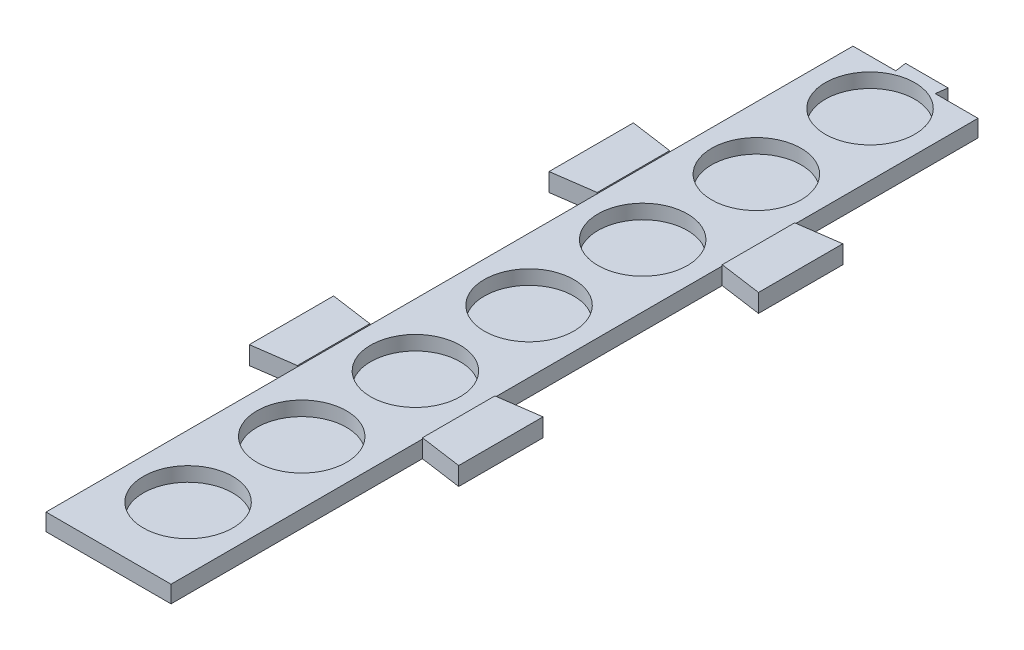
from build123d import *

# Parameters (mm, degrees)
SKETCH1_W           = 27.94
SKETCH1_H           = 391.16
BOSS_EXTRUDE1_DEPTH = 3.81
SKETCH2_R           = 10
CUT_EXTRUDE1_DEPTH  = 3.21
BOSS_EXTRUDE2_DEPTH = 4.064
SKETCH7_W           = 46.80460671
SKETCH7_H           = 4.064
CUT_EXTRUDE2_DEPTH  = 210.82
BOSS_EXTRUDE4_DEPTH = 4.064


with BuildPart() as part:
    # Sketch1 → Boss-Extrude1 (new body)
    with BuildSketch(Plane(origin=(0, 0, 0), x_dir=(1, 0, 0), z_dir=(0, 1, 0))):
        Rectangle(SKETCH1_W, SKETCH1_H)
    extrude(amount=BOSS_EXTRUDE1_DEPTH)

    # Sketch2 → Cut-Extrude1 (cut)
    with BuildSketch(Plane(origin=(0, 3.81, 0), x_dir=(1, 0, 0), z_dir=(0, 1, 0))):
        with Locations((0, 177.8)):
            Circle(SKETCH2_R)
        with Locations((0, 152.4)):
            Circle(SKETCH2_R)
        with Locations((0, 127)):
            Circle(SKETCH2_R)
        with Locations((0, 101.6)):
            Circle(SKETCH2_R)
        with Locations((0, 76.2)):
            Circle(SKETCH2_R)
        with Locations((0, 50.8)):
            Circle(SKETCH2_R)
        with Locations((0, 25.4)):
            Circle(SKETCH2_R)
        Circle(SKETCH2_R)
        with Locations((0, -25.4)):
            Circle(SKETCH2_R)
        with Locations((0, -50.8)):
            Circle(SKETCH2_R)
        with Locations((0, -76.2)):
            Circle(SKETCH2_R)
        with Locations((0, -101.6)):
            Circle(SKETCH2_R)
        with Locations((0, -127)):
            Circle(SKETCH2_R)
        with Locations((0, -152.4)):
            Circle(SKETCH2_R)
        with Locations((0, -177.8)):
            Circle(SKETCH2_R)
    extrude(amount=-CUT_EXTRUDE1_DEPTH, mode=Mode.SUBTRACT)

    # Sketch4 → Boss-Extrude2 (add)
    with BuildSketch(Plane(origin=(0, 0, 0), x_dir=(1, 0, 0), z_dir=(0, 1, 0))):
        Polygon((23.402303355, -54.881033493), (13.97, -56.20665728), (13.97, -72.402209707), (23.402303355, -73.727833493), align=None)
        Polygon((23.402303355, 146.105623787), (13.97, 144.78), (13.97, 128.584447573), (23.402303355, 127.258823787), align=None)
        Polygon((-13.97, 128.584447573), (-13.97, 144.78), (-23.402303355, 146.105623787), (-23.402303355, 127.258823787), align=None)
        Polygon((23.402303355, 79.11007136), (13.97, 77.784447573), (13.97, 61.588895147), (23.402303355, 60.26327136), align=None)
        Polygon((23.402303355, 12.114518933), (13.97, 10.788895147), (13.97, -5.40665728), (23.402303355, -6.732281067), align=None)
        Polygon((-13.97, -5.40665728), (-13.97, 10.788895147), (-23.402303355, 12.114518933), (-23.402303355, -6.732281067), align=None)
        Polygon((-13.97, 61.588895147), (-13.97, 77.784447573), (-23.402303355, 79.11007136), (-23.402303355, 60.26327136), align=None)
        Polygon((23.402303355, -121.87658592), (13.97, -123.202209707), (13.97, -139.397762134), (23.402303355, -140.72338592), align=None)
        Polygon((-13.97, -139.397762134), (-13.97, -123.202209707), (-23.402303355, -121.87658592), (-23.402303355, -140.72338592), align=None)
        Polygon((-13.97, -72.402209707), (-13.97, -56.20665728), (-23.402303355, -54.881033493), (-23.402303355, -73.727833493), align=None)
    extrude(amount=BOSS_EXTRUDE2_DEPTH)

    # Sketch7 → Cut-Extrude2 (cut)
    with BuildSketch(Plane(origin=(0, 0, -195.58), x_dir=(-1, 0, 0), z_dir=(0, 0, -1))):
        with Locations((0, 2.032)):
            Rectangle(SKETCH7_W, SKETCH7_H)
    extrude(amount=-CUT_EXTRUDE2_DEPTH, mode=Mode.SUBTRACT)

    # Sketch8 → Boss-Extrude4 (add)
    with BuildSketch(Plane(origin=(0, 3.81, 0), x_dir=(1, 0, 0), z_dir=(0, 1, 0))):
        Polygon((-4.40552628, -15.24), (-4.7625, -12.7), (4.7625, -12.7), (4.40552628, -15.24), align=None)
    extrude(amount=-BOSS_EXTRUDE4_DEPTH)


solid = part.part
